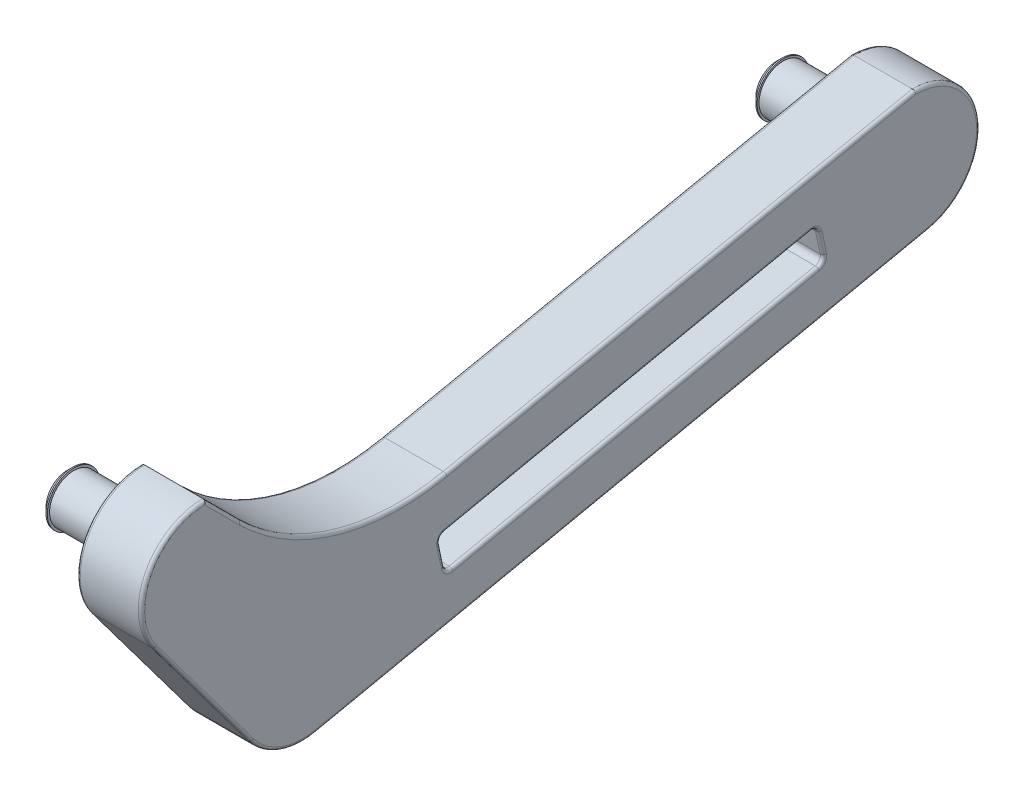
from build123d import *

# Parameters (mm, degrees)
SKETCH_1_R          = 3.75
EXTRUDE_1_DEPTH     = 10
EXTRUDE_START       = -20.5
SKETCH_2_R          = 3.75
SKETCH_2_R_2        = 3.750000000000006
EXTRUDE_2_DEPTH     = 20.5
EXTRUDE_3_DEPTH     = 10
CUT_EXTRUDE_1_DEPTH = 125.1380280172035
CUT_EXTRUDE_2_DEPTH = 10
FILLET_1_R          = 1
SKETCH_6_R          = 4.1
EXTRUDE_4_DEPTH     = 1
CHAMFER_1_SIZE      = 0.8
SKETCH_7_R          = 4.0500000000000025
EXTRUDE_5_DEPTH     = 1
CHAMFER_2_SIZE      = 0.8
FILLET_2_R          = 0.5


with BuildPart() as part:
    # 草图1 → 凸台-拉伸1 (new body)
    with BuildSketch(Plane(origin=(0, 0, 0), x_dir=(0, 0, -1), z_dir=(1, 0, 0))):
        with BuildLine():
            Line((0, 10), (110, 10))
            ThreePointArc((110, 10), (120, 0), (110, -10))
            Line((110, -10), (0, -10))
            ThreePointArc((0, -10), (-10, 1.22e-15), (0, 10))
        make_face()
        Circle(SKETCH_1_R, mode=Mode.SUBTRACT)
    extrude(amount=EXTRUDE_1_DEPTH)

    # 草图2 → 凸台-拉伸2 (add)
    with BuildSketch(Plane(origin=(10, 0, 0), x_dir=(0, 0, -1), z_dir=(1, 0, 0)).offset(EXTRUDE_START)):
        Circle(SKETCH_2_R)
        with Locations((110, 0)):
            Circle(SKETCH_2_R_2)
    extrude(amount=EXTRUDE_2_DEPTH)

    # 草图3 → 凸台-拉伸3 (add)
    with BuildSketch(Plane.ZY):
        with BuildLine():
            Line((8.000000000000004, -6.000000000000001), (-6.999999999999994, -26.000000000000007))
            ThreePointArc((-6.999999999999994, -26.000000000000007), (-11.478198300811945, -29.35932223996996), (-17.06010481049842, -29.785497849867497))
            Line((-17.06010481049842, -29.785497849867497), (-112.06010481049843, -9.78549784986749))
            ThreePointArc((-112.06010481049843, -9.78549784986749), (-119.94622990129112, 1.0356209493161885), (-110, 10))
            Line((-110, 10), (6.1e-16, 10))
            ThreePointArc((6.1e-16, 10), (8.944271909999161, 4.472135954999581), (8.000000000000004, -6.000000000000001))
        make_face()
    extrude(amount=-EXTRUDE_3_DEPTH)

    # 草图4 → 切除-拉伸1 (cut, through all)
    with BuildSketch(Plane.ZY):
        with BuildLine():
            Line((6.1e-16, 10), (-5.470582889553741, 4.52941711044617))
            ThreePointArc((-5.470582889553741, 4.52941711044617), (-20.178286006408143, -4.250603826537166), (-37.29096271119613, -4.999999999999999))
            Line((-37.29096271119613, -4.999999999999999), (-110, 10))
            Line((-110, 10), (6.1e-16, 10))
        make_face()
    extrude(amount=-CUT_EXTRUDE_1_DEPTH, mode=Mode.SUBTRACT)

    # 草图5 → 切除-拉伸2 (cut)
    with BuildSketch(Plane(origin=(10, 0, 0), x_dir=(0, 0, -1), z_dir=(1, 0, 0))):
        Polygon((37.22679756914188, -18.386435433698708), (36.093739923367764, -13.004411616271586), (94.8067270225727, -0.643782753281124), (95.93978466834682, -6.0258065707081885), align=None)
    extrude(amount=-CUT_EXTRUDE_2_DEPTH, mode=Mode.SUBTRACT)

    # 圆角1
    fillet_1_edges = [part.edges().sort_by_distance(p)[0] for p in [
        (5, -6.0258065707081885, -95.93978466834682),
        (5, -18.386435433698708, -37.22679756914188),
        (5, -13.004411616271586, -36.093739923367764),
        (5, -0.643782753281124, -94.8067270225727),
    ]]
    fillet(fillet_1_edges, radius=FILLET_1_R)

    # 草图6 → 凸台-拉伸4 (add)
    with BuildSketch(Plane.ZY.offset(10.5)):
        Circle(SKETCH_6_R)
    extrude(amount=EXTRUDE_4_DEPTH)

    # 倒角1
    chamfer_1_edges = [part.edges().sort_by_distance(p)[0] for p in [
        (-11.5, 5e-16, -4.1),
    ]]
    chamfer(chamfer_1_edges, length=CHAMFER_1_SIZE)

    # 草图7 → 凸台-拉伸5 (add)
    with BuildSketch(Plane.ZY.offset(10.5)):
        with Locations((-110, 0)):
            Circle(SKETCH_7_R)
    extrude(amount=EXTRUDE_5_DEPTH)

    # 倒角2
    chamfer_2_edges = [part.edges().sort_by_distance(p)[0] for p in [
        (-11.5, 5e-16, -114.05),
    ]]
    chamfer(chamfer_2_edges, length=CHAMFER_2_SIZE)

    # 圆角2
    # the kernel refuses this fillet: 0.5 mm, written as the material it adds along each edge
    with BuildSketch(Plane(origin=(0, 0, 0), x_dir=(0, 0, -1), z_dir=(0, -1, 0))) as fillet_2_piece_1:
        with BuildLine():
            CenterArc((3.75 + FILLET_2_R, -FILLET_2_R), FILLET_2_R, 90, 90)
            Line((3.75, -FILLET_2_R), (3.75, 0))
            Line((3.75, 0), (3.75 + FILLET_2_R, 0))
        make_face()
    revolve(axis=Axis((0, 0, 0), (1, 0, 0)))
    with BuildSketch(Plane(origin=(0, 0, -110), x_dir=(0, 0, -1), z_dir=(0, 1, 0))) as fillet_2_piece_2:
        with BuildLine():
            CenterArc((3.75 + FILLET_2_R, FILLET_2_R), FILLET_2_R, 180, 90)
            Line((3.75 + FILLET_2_R, 0), (3.75, 0))
            Line((3.75, 0), (3.75, FILLET_2_R))
        make_face()
    revolve(axis=Axis((0, 0, -110), (-1, 0, 0)))
    # the kernel refuses this fillet: 0.5 mm, written as the material it takes off along each edge
    with BuildSketch(Plane(origin=(0, -8.9e-16, -110), x_dir=(0, 0.992175793893205, 0.12484868446398849), z_dir=(0, -0.12484868446398849, 0.992175793893205))) as fillet_2_2_piece_1:
        with BuildLine():
            CenterArc((10.000000000000004 - FILLET_2_R, -FILLET_2_R), FILLET_2_R, 1.272e-14, 90)
            Line((10.000000000000004, -FILLET_2_R), (10.000000000000004, 0))
            Line((10.000000000000004, 0), (10.000000000000004 - FILLET_2_R, 0))
        make_face()
    revolve(axis=Axis((0, -8.9e-16, -110), (-1, 0, 0)), revolution_arc=175.28335954758495, mode=Mode.SUBTRACT)
    with BuildSketch(Plane(origin=(10, -8.9e-16, -110), x_dir=(0, 0.992175793893205, 0.12484868446398853), z_dir=(0, -0.12484868446398853, 0.992175793893205))) as fillet_2_2_piece_2:
        with BuildLine():
            CenterArc((9.999999999999998 - FILLET_2_R, FILLET_2_R), FILLET_2_R, 270, 90)
            Line((9.999999999999998 - FILLET_2_R, 0), (9.999999999999998, 0))
            Line((9.999999999999998, 0), (10.000000000000002, FILLET_2_R))
        make_face()
    revolve(axis=Axis((10, -8.9e-16, -110), (-1, 0, 0)), revolution_arc=175.28335954758495, mode=Mode.SUBTRACT)
    with BuildSketch(Plane(origin=(0, -29.785497849867497, -17.06010481049842), x_dir=(0, 0.9785497849867489, 0.20601048104984193), z_dir=(0, 0.20601048104984196, -0.978549784986749))) as fillet_2_2_piece_3:
        with BuildLine():
            CenterArc((FILLET_2_R, FILLET_2_R), FILLET_2_R, 180, 90)
            Line((0, FILLET_2_R), (0, 0))
            Line((0, 0), (FILLET_2_R, 0))
        make_face()
    extrude(amount=97.08243919473801, mode=Mode.SUBTRACT)
    with BuildSketch(Plane(origin=(0, -20.000000000000007, -14.999999999999993), x_dir=(0, -0.6, 0.8), z_dir=(0, 0.8, 0.6))) as fillet_2_2_piece_4:
        with BuildLine():
            CenterArc((10 - FILLET_2_R, FILLET_2_R), FILLET_2_R, 270, 90)
            Line((10, FILLET_2_R), (10, 0))
            Line((10, 0), (10 - FILLET_2_R, 0))
        make_face()
    revolve(axis=Axis((0, -20.000000000000007, -14.999999999999993), (1, 0, 0)), revolution_arc=65.01876039378399, mode=Mode.SUBTRACT)
    with BuildSketch(Plane(origin=(0, -6.000000000000001, 8.000000000000004), x_dir=(0, 0.5999999999999999, -0.8000000000000003), z_dir=(0, -0.8000000000000003, -0.5999999999999999))) as fillet_2_2_piece_5:
        with BuildLine():
            CenterArc((FILLET_2_R, FILLET_2_R), FILLET_2_R, 180, 90)
            Line((1.95e-15, FILLET_2_R), (0, 0))
            Line((0, 0), (FILLET_2_R, 0))
        make_face()
    extrude(amount=25.000000000000007, mode=Mode.SUBTRACT)
    with BuildSketch(Plane(origin=(10, -6.000000000000001, 8.000000000000004), x_dir=(-1, 0, 0), z_dir=(0, -0.8000000000000003, -0.5999999999999999))) as fillet_2_2_piece_6:
        with BuildLine():
            CenterArc((FILLET_2_R, FILLET_2_R), FILLET_2_R, 179.99999999999986, 90.00000000000011)
            Line((0, FILLET_2_R), (0, 0))
            Line((0, 0), (FILLET_2_R, 0))
        make_face()
    extrude(amount=25.000000000000007, mode=Mode.SUBTRACT)
    with BuildSketch(Plane(origin=(10, -20.000000000000007, -14.999999999999993), x_dir=(0, -0.6, 0.8), z_dir=(0, 0.8, 0.6))) as fillet_2_2_piece_7:
        with BuildLine():
            CenterArc((10 - FILLET_2_R, -FILLET_2_R), FILLET_2_R, 0, 89.9999999999998)
            Line((10 - FILLET_2_R, 0), (10, 0))
            Line((10, 0), (10, -FILLET_2_R))
        make_face()
    revolve(axis=Axis((10, -20.000000000000007, -14.999999999999993), (1, 0, 0)), revolution_arc=65.01876039378399, mode=Mode.SUBTRACT)
    with BuildSketch(Plane(origin=(10, -29.785497849867497, -17.06010481049842), x_dir=(-1, 0, 0), z_dir=(0, 0.20601048104984196, -0.978549784986749))) as fillet_2_2_piece_8:
        with BuildLine():
            CenterArc((FILLET_2_R, FILLET_2_R), FILLET_2_R, 180.00000000000009, 89.99999999999989)
            Line((0, FILLET_2_R), (0, 0))
            Line((0, 0), (FILLET_2_R, 0))
        make_face()
    extrude(amount=97.08243919473801, mode=Mode.SUBTRACT)
    with BuildSketch(Plane(origin=(10, 0, 0), x_dir=(0, -0.5999999999999998, 0.8000000000000002), z_dir=(0, -0.8000000000000002, -0.5999999999999998))) as fillet_2_2_piece_9:
        with BuildLine():
            CenterArc((10 - FILLET_2_R, FILLET_2_R), FILLET_2_R, 270, 90)
            Line((10 - FILLET_2_R, 0), (10, 0))
            Line((10, 0), (10, FILLET_2_R))
        make_face()
    revolve(axis=Axis((10, 0, 0), (-1, 0, 0)), revolution_arc=134.0375887678595, mode=Mode.SUBTRACT)
    with BuildSketch(Plane(origin=(10, 10.883883476483195, 0.8838834764831808), x_dir=(-1, -1.22e-15, 1.22e-15), z_dir=(0, -0.7071067811865532, -0.7071067811865419))) as fillet_2_2_piece_10:
        with BuildLine():
            CenterArc((FILLET_2_R, -FILLET_2_R), FILLET_2_R, 90.0000000000001, 89.99999999999964)
            Line((8.6e-16, -FILLET_2_R), (0, 0))
            Line((0, 0), (FILLET_2_R, 0))
        make_face()
    extrude(amount=8.986572516493164, mode=Mode.SUBTRACT)
    with BuildSketch(Plane(origin=(10, 29.278154451975112, -30.219320231083127), x_dir=(0, -0.979375841485003, -0.20204692800322924), z_dir=(0, 0.20204692800322924, -0.979375841485003))) as fillet_2_2_piece_11:
        with BuildLine():
            CenterArc((34.99999999999999 + FILLET_2_R, FILLET_2_R), FILLET_2_R, 180, 90)
            Line((34.99999999999999 + FILLET_2_R, 0), (34.99999999999999, 0))
            Line((34.99999999999999, 0), (34.99999999999999, FILLET_2_R))
        make_face()
    revolve(axis=Axis((10, 29.278154451975112, -30.219320231083127), (-1, 0, 0)), revolution_arc=56.65668339446081, mode=Mode.SUBTRACT)
    with BuildSketch(Plane(origin=(10, -5, -37.29096271119613), x_dir=(-1, 1.7e-15, 3.5e-16), z_dir=(0, 0.20204692800322901, -0.9793758414850032))) as fillet_2_2_piece_12:
        with BuildLine():
            CenterArc((FILLET_2_R, -FILLET_2_R), FILLET_2_R, 89.9999999999999, 90.0000000000001)
            Line((-8.7e-16, -FILLET_2_R), (0, 0))
            Line((0, 0), (FILLET_2_R, 0))
        make_face()
    extrude(amount=75.49017849833521, mode=Mode.SUBTRACT)
    with BuildSketch(Plane(origin=(0, -4.999999999999999, -37.29096271119613), x_dir=(0, -0.9793758414850032, -0.202046928003229), z_dir=(0, 0.202046928003229, -0.9793758414850031))) as fillet_2_2_piece_13:
        with BuildLine():
            CenterArc((FILLET_2_R, -FILLET_2_R), FILLET_2_R, 90, 90)
            Line((0, -FILLET_2_R), (0, 0))
            Line((0, 0), (FILLET_2_R, 0))
        make_face()
    extrude(amount=75.4901784983352, mode=Mode.SUBTRACT)
    with BuildSketch(Plane(origin=(0, 29.278154451975112, -30.219320231083127), x_dir=(0, -0.7071067811865412, 0.7071067811865538), z_dir=(0, 0.7071067811865538, 0.7071067811865412))) as fillet_2_2_piece_14:
        with BuildLine():
            CenterArc((35 + FILLET_2_R, FILLET_2_R), FILLET_2_R, 180, 90)
            Line((35, FILLET_2_R), (35, 0))
            Line((35, 0), (35 + FILLET_2_R, 0))
        make_face()
    revolve(axis=Axis((0, 29.278154451975112, -30.219320231083127), (1, 0, 0)), revolution_arc=56.65668339446079, mode=Mode.SUBTRACT)
    with BuildSketch(Plane(origin=(0, 10.883883476483193, 0.8838834764831773), x_dir=(0, -0.7071067811865419, 0.7071067811865532), z_dir=(0, -0.7071067811865532, -0.7071067811865419))) as fillet_2_2_piece_15:
        with BuildLine():
            CenterArc((FILLET_2_R, -FILLET_2_R), FILLET_2_R, 90, 90)
            Line((7.9e-16, -FILLET_2_R), (0, 0))
            Line((0, 0), (FILLET_2_R, 0))
        make_face()
    extrude(amount=8.986572516493164, mode=Mode.SUBTRACT)
    with BuildSketch(Plane(origin=(0, 0, 0), x_dir=(0, -0.5999999999999998, 0.8000000000000002), z_dir=(0, -0.8000000000000002, -0.5999999999999998))) as fillet_2_2_piece_16:
        with BuildLine():
            CenterArc((10 - FILLET_2_R, -FILLET_2_R), FILLET_2_R, 6.36e-15, 90)
            Line((10, -FILLET_2_R), (10, 0))
            Line((10, 0), (10 - FILLET_2_R, 0))
        make_face()
    revolve(axis=Axis((0, 0, 0), (-1, 0, 0)), revolution_arc=134.0375887678595, mode=Mode.SUBTRACT)
    with BuildSketch(Plane(origin=(10, -6.231817051758028, -94.96123488336008), x_dir=(-1, 0, 0), z_dir=(0, -0.20601048104984204, 0.978549784986749))) as fillet_2_2_piece_17:
        with BuildLine():
            CenterArc((FILLET_2_R, FILLET_2_R), FILLET_2_R, 180, 90)
            Line((0, FILLET_2_R), (0, 0))
            Line((0, 0), (FILLET_2_R, 0))
        make_face()
    extrude(amount=58.00000000000001, mode=Mode.SUBTRACT)
    with BuildSketch(Plane(origin=(0, -6.231817051758028, -94.96123488336008), x_dir=(0, -0.978549784986749, -0.20601048104984207), z_dir=(0, -0.20601048104984204, 0.978549784986749))) as fillet_2_2_piece_18:
        with BuildLine():
            CenterArc((FILLET_2_R, FILLET_2_R), FILLET_2_R, 180, 90)
            Line((0, FILLET_2_R), (0, 0))
            Line((0, 0), (FILLET_2_R, 0))
        make_face()
    extrude(amount=58.00000000000001, mode=Mode.SUBTRACT)
    with BuildSketch(Plane(origin=(10, -17.407885648711957, -37.02078708809204), x_dir=(-1, 0, 0), z_dir=(0, 0.9785497849867496, 0.2060104810498393))) as fillet_2_2_piece_19:
        with BuildLine():
            CenterArc((FILLET_2_R, FILLET_2_R), FILLET_2_R, 180, 90)
            Line((0, FILLET_2_R), (0, 0))
            Line((0, 0), (FILLET_2_R, 0))
        make_face()
    extrude(amount=3.4999999999999982, mode=Mode.SUBTRACT)
    with BuildSketch(Plane(origin=(0, -17.407885648711957, -37.02078708809204), x_dir=(0, -0.2060104810498393, 0.9785497849867497), z_dir=(0, 0.9785497849867496, 0.2060104810498393))) as fillet_2_2_piece_20:
        with BuildLine():
            CenterArc((FILLET_2_R, FILLET_2_R), FILLET_2_R, 180, 90)
            Line((0, FILLET_2_R), (0, 0))
            Line((0, 0), (FILLET_2_R, 0))
        make_face()
    extrude(amount=3.4999999999999982, mode=Mode.SUBTRACT)
    with BuildSketch(Plane(origin=(10, -1.6223325382678755, -95.01273750362255), x_dir=(-1, -4.7e-16, 2.24e-15), z_dir=(0, -0.9785497849867492, -0.20601048104984138))) as fillet_2_2_piece_21:
        with BuildLine():
            CenterArc((FILLET_2_R, FILLET_2_R), FILLET_2_R, 180.00000000000003, 90.00000000000011)
            Line((-1.14e-15, FILLET_2_R), (0, 0))
            Line((0, 0), (FILLET_2_R, 0))
        make_face()
    extrude(amount=3.499999999999946, mode=Mode.SUBTRACT)
    with BuildSketch(Plane(origin=(0, -1.6223325382678755, -95.01273750362255), x_dir=(0, 0.2060104810498414, -0.9785497849867492), z_dir=(0, -0.9785497849867492, -0.20601048104984138))) as fillet_2_2_piece_22:
        with BuildLine():
            CenterArc((FILLET_2_R, FILLET_2_R), FILLET_2_R, 180, 90)
            Line((-1.1e-15, FILLET_2_R), (0, 0))
            Line((0, 0), (FILLET_2_R, 0))
        make_face()
    extrude(amount=3.499999999999946, mode=Mode.SUBTRACT)
    with BuildSketch(Plane(origin=(10, -12.798401135221745, -37.07228970835451), x_dir=(-1, 0, 0), z_dir=(0, 0.2060104810498411, -0.9785497849867493))) as fillet_2_2_piece_23:
        with BuildLine():
            CenterArc((FILLET_2_R, FILLET_2_R), FILLET_2_R, 180, 90)
            Line((0, FILLET_2_R), (0, 0))
            Line((0, 0), (FILLET_2_R, 0))
        make_face()
    extrude(amount=57.999999999999986, mode=Mode.SUBTRACT)
    with BuildSketch(Plane(origin=(0, -12.798401135221745, -37.07228970835451), x_dir=(0, 0.9785497849867493, 0.20601048104984113), z_dir=(0, 0.2060104810498411, -0.9785497849867493))) as fillet_2_2_piece_24:
        with BuildLine():
            CenterArc((FILLET_2_R, FILLET_2_R), FILLET_2_R, 180, 90)
            Line((0, FILLET_2_R), (0, 0))
            Line((0, 0), (FILLET_2_R, 0))
        make_face()
    extrude(amount=57.999999999999986, mode=Mode.SUBTRACT)
    with BuildSketch(Plane(origin=(10, -17.201875167662116, -37.99933687307879), x_dir=(0, -0.20601048104984135, 0.9785497849867492), z_dir=(0, 0.9785497849867492, 0.20601048104984135))) as fillet_2_2_piece_25:
        with BuildLine():
            CenterArc((0.9999999999999977 + FILLET_2_R, -FILLET_2_R), FILLET_2_R, 90.00000000000007, 89.99999999999994)
            Line((0.9999999999999977 + FILLET_2_R, 0), (0.9999999999999977, 0))
            Line((0.9999999999999977, 0), (0.9999999999999984, -FILLET_2_R))
        make_face()
    revolve(axis=Axis((10, -17.201875167662116, -37.99933687307879), (1, 0, 0)), revolution_arc=90.00000000000023, mode=Mode.SUBTRACT)
    with BuildSketch(Plane(origin=(0, -17.201875167662116, -37.99933687307879), x_dir=(0, -0.20601048104984135, 0.9785497849867492), z_dir=(0, 0.9785497849867492, 0.20601048104984135))) as fillet_2_2_piece_26:
        with BuildLine():
            CenterArc((0.9999999999999977 + FILLET_2_R, FILLET_2_R), FILLET_2_R, 180, 90)
            Line((0.9999999999999984, FILLET_2_R), (0.9999999999999977, 0))
            Line((0.9999999999999977, 0), (0.9999999999999977 + FILLET_2_R, 0))
        make_face()
    revolve(axis=Axis((0, -17.201875167662116, -37.99933687307879), (1, 0, 0)), revolution_arc=90.00000000000023, mode=Mode.SUBTRACT)
    with BuildSketch(Plane(origin=(10, -5.253267266771284, -94.75522440231023), x_dir=(0, 0.20601048104984165, -0.9785497849867492), z_dir=(0, 0.9785497849867492, 0.20601048104984165))) as fillet_2_2_piece_27:
        with BuildLine():
            CenterArc((1.000000000000005 + FILLET_2_R, FILLET_2_R), FILLET_2_R, 180, 90)
            Line((1.000000000000005 + FILLET_2_R, 0), (1.000000000000005, 0))
            Line((1.000000000000005, 0), (1.0000000000000047, FILLET_2_R))
        make_face()
    revolve(axis=Axis((10, -5.253267266771284, -94.75522440231023), (-1, 0, 0)), revolution_arc=89.99999999999984, mode=Mode.SUBTRACT)
    with BuildSketch(Plane(origin=(0, -5.253267266771284, -94.75522440231023), x_dir=(0, 0.20601048104984165, -0.9785497849867492), z_dir=(0, 0.9785497849867492, 0.20601048104984165))) as fillet_2_2_piece_28:
        with BuildLine():
            CenterArc((1.000000000000005 + FILLET_2_R, -FILLET_2_R), FILLET_2_R, 90, 90)
            Line((1.0000000000000047, -FILLET_2_R), (1.000000000000005, 0))
            Line((1.000000000000005, 0), (1.000000000000005 + FILLET_2_R, 0))
        make_face()
    revolve(axis=Axis((0, -5.253267266771284, -94.75522440231023), (-1, 0, 0)), revolution_arc=89.99999999999984, mode=Mode.SUBTRACT)
    with BuildSketch(Plane(origin=(10, -1.8283430193177137, -94.0341877186358), x_dir=(0, 0.9785497849867486, 0.20601048104984443), z_dir=(0, -0.20601048104984443, 0.9785497849867486))) as fillet_2_2_piece_29:
        with BuildLine():
            CenterArc((1.0000000000000002 + FILLET_2_R, FILLET_2_R), FILLET_2_R, 180, 89.99999999999994)
            Line((1.0000000000000002 + FILLET_2_R, 0), (1.0000000000000002, 0))
            Line((1.0000000000000002, 0), (1.000000000000001, FILLET_2_R))
        make_face()
    revolve(axis=Axis((10, -1.8283430193177137, -94.0341877186358), (-1, 0, 0)), revolution_arc=90.0000000000003, mode=Mode.SUBTRACT)
    with BuildSketch(Plane(origin=(0, -1.8283430193177137, -94.0341877186358), x_dir=(0, 0.9785497849867486, 0.20601048104984443), z_dir=(0, -0.20601048104984443, 0.9785497849867486))) as fillet_2_2_piece_30:
        with BuildLine():
            CenterArc((1.0000000000000002 + FILLET_2_R, -FILLET_2_R), FILLET_2_R, 90, 90)
            Line((1.0000000000000007, -FILLET_2_R), (1.0000000000000002, 0))
            Line((1.0000000000000002, 0), (1.0000000000000002 + FILLET_2_R, 0))
        make_face()
    revolve(axis=Axis((0, -1.8283430193177137, -94.0341877186358), (-1, 0, 0)), revolution_arc=90.0000000000003, mode=Mode.SUBTRACT)
    with BuildSketch(Plane(origin=(10, -13.776950920208495, -37.278300189404355), x_dir=(0, -0.20601048104984135, 0.9785497849867492), z_dir=(0, -0.9785497849867492, -0.20601048104984135))) as fillet_2_2_piece_31:
        with BuildLine():
            CenterArc((0.9999999999999977 + FILLET_2_R, FILLET_2_R), FILLET_2_R, 180, 90.00000000000006)
            Line((0.9999999999999977 + FILLET_2_R, 0), (0.9999999999999977, 0))
            Line((0.9999999999999977, 0), (0.9999999999999973, FILLET_2_R))
        make_face()
    revolve(axis=Axis((10, -13.776950920208495, -37.278300189404355), (-1, 0, 0)), revolution_arc=90.0000000000002, mode=Mode.SUBTRACT)
    with BuildSketch(Plane(origin=(0, -13.776950920208495, -37.278300189404355), x_dir=(0, -0.20601048104984135, 0.9785497849867492), z_dir=(0, -0.9785497849867492, -0.20601048104984135))) as fillet_2_2_piece_32:
        with BuildLine():
            CenterArc((0.9999999999999977 + FILLET_2_R, -FILLET_2_R), FILLET_2_R, 90, 90)
            Line((0.9999999999999973, -FILLET_2_R), (0.9999999999999977, 0))
            Line((0.9999999999999977, 0), (0.9999999999999977 + FILLET_2_R, 0))
        make_face()
    revolve(axis=Axis((0, -13.776950920208495, -37.278300189404355), (-1, 0, 0)), revolution_arc=90.0000000000002, mode=Mode.SUBTRACT)


solid = part.part
